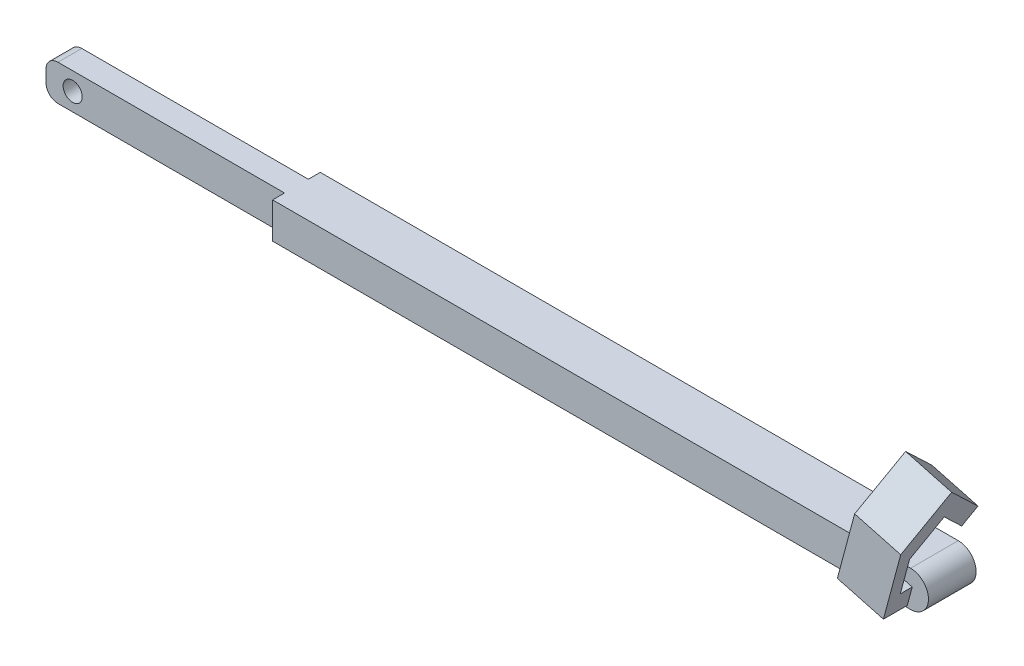
from build123d import *

# Parameters (mm, degrees)
SKETCH1_R            = 2
BOSS_EXTRUDE1_DEPTH  = 10
BOSS_EXTRUDE2_DEPTH  = 5
SKETCH11_W           = 10
SKETCH11_H           = 2.5
BOSS_EXTRUDE9_DEPTH  = 10
CHAMFER4_SIZE        = 2.5
BOSS_EXTRUDE10_DEPTH = 12
BOSS_EXTRUDE11_DEPTH = 7
SKETCH14_W           = 37.56586606
SKETCH14_H           = 7.5
CUT_EXTRUDE2_DEPTH   = 99.023663822
SKETCH15_W           = 5
SKETCH15_H           = 7.5
BOSS_EXTRUDE12_DEPTH = 50
FILLET1_R            = 2.5
FILLET2_R            = 2.5
SKETCH16_R           = 2
CUT_EXTRUDE3_DEPTH   = 50


with BuildPart() as part:
    # Sketch1 → Boss-Extrude1 (new body)
    with BuildSketch(Plane.XY):
        with BuildLine():
            Line((-90, 3.75), (90, 3.75))
            ThreePointArc((90, 3.75), (93.75, 0), (90, -3.75))
            Line((90, -3.75), (-90, -3.75))
            ThreePointArc((-90, -3.75), (-93.75, 0), (-90, 3.75))
        make_face()
        with Locations((-90, 0)):
            Circle(SKETCH1_R, mode=Mode.SUBTRACT)
    extrude(amount=BOSS_EXTRUDE1_DEPTH)

    # Sketch2 → Boss-Extrude2 (add)
    with BuildSketch(Plane.XY.offset(10)):
        Polygon((80.687913142, 3.098319394), (90.347171405, 0.510128943), (89.311895225, -3.353574362), (79.652636962, -0.765383911), align=None)
    extrude(amount=BOSS_EXTRUDE2_DEPTH)

    # Sketch11 → Boss-Extrude9 (add)
    with BuildSketch(Plane(origin=(6.17964514, 23.062749635, 0), x_dir=(0.9659258262890681, -0.25881904510252146, 0), z_dir=(0.25881904510252146, 0.9659258262890681, 0))):
        with Locations((82.136635107, -13.75)):
            Rectangle(SKETCH11_W, SKETCH11_H)
    extrude(amount=BOSS_EXTRUDE9_DEPTH)

    # Chamfer4
    chamfer4_edges = [part.edges().sort_by_distance(p)[0] for p in [
        (88.105732725, 11.463482432, 12.5),
    ]]
    chamfer(chamfer4_edges, length=CHAMFER4_SIZE - 0.0001)  # a hair under: the kernel refuses the full size

    # Sketch12 → Boss-Extrude10 (add)
    with BuildSketch(Plane(origin=(2.442774957, 9.116560252, -9.438157676), x_dir=(-0.9831105418930532, 0.12706287081893997, -0.1317144231965381), z_dir=(0.18301270189222077, 0.683012701892222, -0.7071067811865448))):
        Polygon((-91.390726655, 14.25109763), (-81.565745121, 16.113820866), (-82.224317237, 19.5874764), (-92.049298771, 17.724753164), align=None)
    extrude(amount=BOSS_EXTRUDE10_DEPTH)

    # Sketch13 → Boss-Extrude11 (add)
    with BuildSketch(Plane(origin=(5.678013021, 21.19063308, 21.938157676), x_dir=(-0.9831105418930535, 0.1270628708189395, 0.13171442319653667), z_dir=(-0.18301270189221938, -0.6830127018922167, -0.70710678118655))):
        Polygon((-90.333133958, 8.672797801), (-80.508152424, 10.535521038), (-79.792866702, 6.762728129), (-89.617848236, 4.900004892), align=None)
    extrude(amount=BOSS_EXTRUDE11_DEPTH)

    # Sketch14 → Cut-Extrude2 (cut, through all)
    with BuildSketch(Plane.XY.offset(10)):
        with Locations((-62.53293303, 0)):
            Rectangle(SKETCH14_W, SKETCH14_H)
    extrude(amount=-CUT_EXTRUDE2_DEPTH, mode=Mode.SUBTRACT)


with BuildPart() as body_2:
    # of the pieces the cut leaves, the one that is kept (cut_extrude2_keep)
    add(part.part.solids().sort_by_distance((79.652636962, -0.765383911, 15))[0])

    # Sketch15 → Boss-Extrude12 (add)
    with BuildSketch(Plane.ZY.offset(43.75)):
        with Locations((5, 0)):
            Rectangle(SKETCH15_W, SKETCH15_H)
    extrude(amount=BOSS_EXTRUDE12_DEPTH)

    # Fillet1
    fillet1_edges = [body_2.edges().sort_by_distance(p)[0] for p in [
        (-93.75, 3.75, 5),
    ]]
    fillet(fillet1_edges, radius=FILLET1_R)

    # Fillet2
    fillet2_edges = [body_2.edges().sort_by_distance(p)[0] for p in [
        (-93.75, -3.75, 5),
    ]]
    fillet(fillet2_edges, radius=FILLET2_R)

    # Sketch16 → Cut-Extrude3 (cut)
    with BuildSketch(Plane.XY.offset(7.5)):
        with Locations((-88.159990551, 0)):
            Circle(SKETCH16_R)
    extrude(amount=-CUT_EXTRUDE3_DEPTH, mode=Mode.SUBTRACT)


solid = body_2.part
